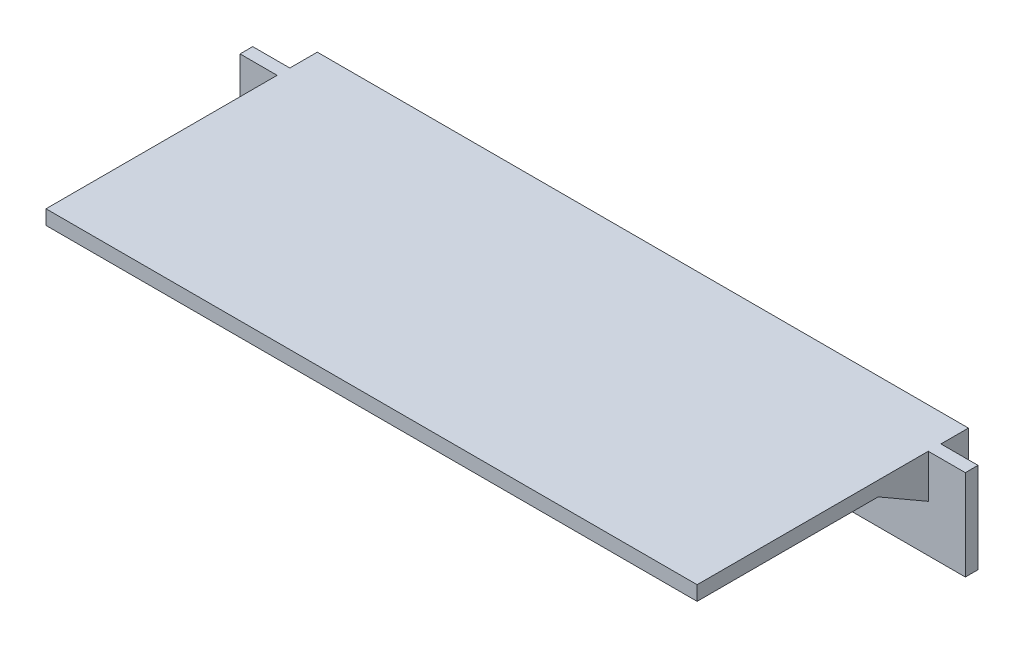
from build123d import *

# Parameters (mm, degrees)
SKETCH1_W           = 200.5
SKETCH1_H           = 3.5
BOSS_EXTRUDE1_DEPTH = 21
SKETCH3_W           = 180
SKETCH3_H           = 75
BOSS_EXTRUDE2_DEPTH = 4
CHAMFER1_SIZE       = 8
CHAMFER1_SIZE_2     = 13.856406461
SKETCH4_W           = 10.25
SKETCH4_H           = 3.5
BOSS_EXTRUDE3_DEPTH = 4


with BuildPart() as part:
    # Sketch1 → Boss-Extrude1 (new body)
    with BuildSketch(Plane(origin=(0, 0, 0), x_dir=(1, 0, 0), z_dir=(0, 1, 0))):
        Rectangle(SKETCH1_W, SKETCH1_H)
    extrude(amount=BOSS_EXTRUDE1_DEPTH)

    # Sketch3 → Boss-Extrude2 (add)
    with BuildSketch(Plane(origin=(0, 21, 0), x_dir=(1, 0, 0), z_dir=(0, 1, 0))):
        with Locations((0, -28.15)):
            Rectangle(SKETCH3_W, SKETCH3_H)
    extrude(amount=BOSS_EXTRUDE2_DEPTH)

    # Chamfer1
    # the kernel refuses this chamfer: 13.856406461, 8 mm, written as the material it adds along each edge
    with BuildSketch(Plane(origin=(-90, 21, -1.75), x_dir=(0, -0.9983227437537926, 0.0578938624026714), z_dir=(1, 0, 0))) as chamfer1_piece_1_section:
        Polygon((CHAMFER1_SIZE * 0.998322743754, CHAMFER1_SIZE * 0.0578938624027), (-CHAMFER1_SIZE_2 * 0.0578938624008, CHAMFER1_SIZE_2 * 0.998322743721), (0, 0), align=None)
    chamfer1_piece_1 = extrude(amount=180, mode=Mode.PRIVATE)
    chamfer1_piece_1 = split(chamfer1_piece_1, bisect_by=Plane(origin=(0, 17.958795912, -9.35), z_dir=(0, 0, 1)), keep=Keep.TOP, mode=Mode.PRIVATE)
    add(chamfer1_piece_1)
    with BuildSketch(Plane(origin=(90, 21, 1.75), x_dir=(0, -0.9983227437537926, -0.0578938624026714), z_dir=(-1, 0, 0))) as chamfer1_piece_2:
        Polygon((CHAMFER1_SIZE * 0.998322743754, CHAMFER1_SIZE * 0.0578938624027), (-CHAMFER1_SIZE_2 * 0.0578938624008, CHAMFER1_SIZE_2 * 0.998322743721), (0, 0), align=None)
    extrude(amount=180)

    # Sketch4 → Boss-Extrude3 (add)
    with BuildSketch(Plane(origin=(0, 21, 0), x_dir=(1, 0, 0), z_dir=(0, 1, 0))):
        with Locations((-95.125, 0)):
            Rectangle(SKETCH4_W, SKETCH4_H)
        with Locations((95.125, 0)):
            Rectangle(SKETCH4_W, SKETCH4_H)
    extrude(amount=BOSS_EXTRUDE3_DEPTH)


solid = part.part
